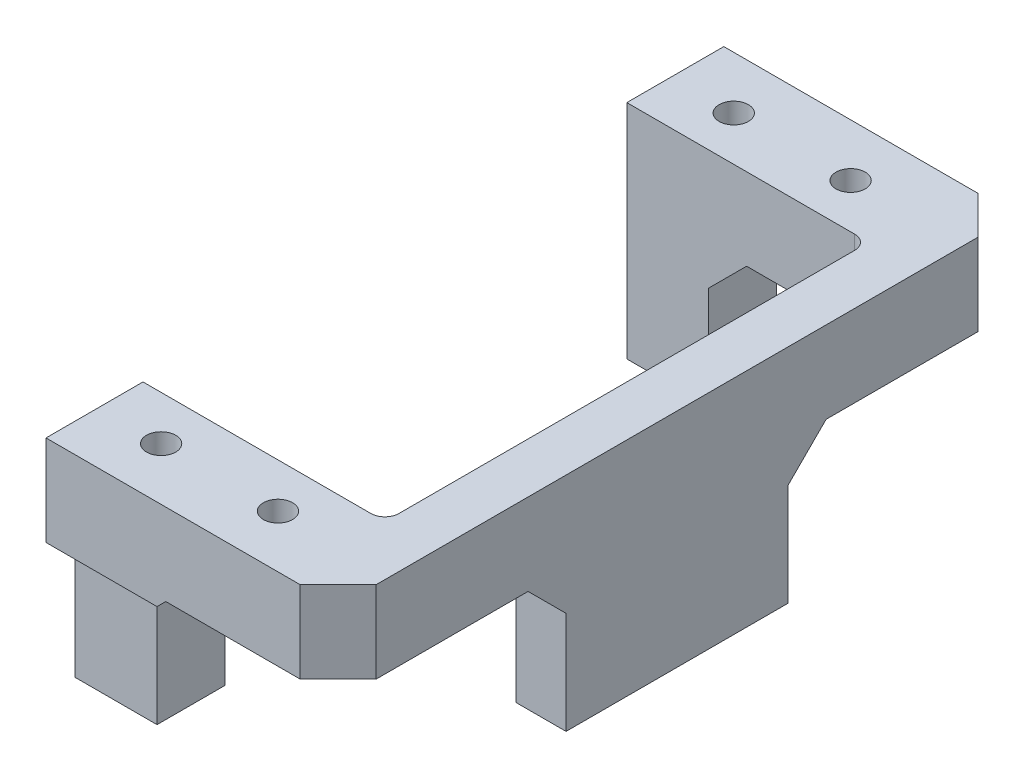
from build123d import *

# Parameters (mm, degrees)
BOSS_EXTRU_1_DEPTH      = 19
ESQUISSE2_W             = 18
ESQUISSE2_H             = 17
ENL_V_MAT_EXTRU_1_DEPTH = 12
TROU_TARAUD_M31_D       = 2.5
TROU_TARAUD_M31_DEPTH   = 8.5
TROU_TARAUD_M31_TIP     = 0.751075774
ESQUISSE7_W             = 25
ESQUISSE7_H             = 8.3
BOSS_EXTRU_2_DEPTH      = 7
CHANFREIN3_SIZE         = 3.25
TROU_TARAUD_M32_D       = 2.5
TROU_TARAUD_M32_DEPTH   = 6
TROU_TARAUD_M32_TIP     = 0.751075774


with BuildPart() as part:
    # Esquisse1 → Boss.-Extru.1 (new body)
    with BuildSketch(Plane(origin=(0, 0, 0), x_dir=(1, 0, 0), z_dir=(0, 1, 0))):
        with BuildLine():
            Line((-9.5, 20.7), (-9.5, 26.5))
            Line((-9.5, 26.5), (15.5, 26.5))
            Line((15.5, 26.5), (15.5, -26.5))
            Line((15.5, -26.5), (-9.5, -26.5))
            Line((-9.5, -26.5), (-9.5, -20.7))
            Line((-9.5, -20.7), (10, -20.7))
            ThreePointArc((10, -20.7), (10.848528137, -20.348528137), (11.2, -19.5))
            Line((11.2, -19.5), (11.2, 19.5))
            ThreePointArc((11.2, 19.5), (10.848528137, 20.348528137), (10, 20.7))
            Line((10, 20.7), (-9.5, 20.7))
        make_face()
    extrude(amount=BOSS_EXTRU_1_DEPTH)

    # Esquisse2 → Enlèv. mat.-Extru.1 (cut)
    with BuildSketch(Plane.XZ):
        with Locations((6.5, 18)):
            Rectangle(ESQUISSE2_W, ESQUISSE2_H)
        with Locations((6.5, -18)):
            Rectangle(ESQUISSE2_W, ESQUISSE2_H)
    extrude(amount=-ENL_V_MAT_EXTRU_1_DEPTH, mode=Mode.SUBTRACT)

    # Trou taraudé M31
    with Locations(Plane(origin=(0, 0, 0), x_dir=(-1, 0, 0), z_dir=(0, -1, 0))):
        with Locations((5.5, 23.6), (-13.35, 0), (5.5, -23.6)):
            Hole(TROU_TARAUD_M31_D / 2, depth=TROU_TARAUD_M31_DEPTH)
            with Locations((0, 0, -(TROU_TARAUD_M31_DEPTH + TROU_TARAUD_M31_TIP / 2))):  # 118° drill point
                Cone(0, TROU_TARAUD_M31_D / 2, TROU_TARAUD_M31_TIP, mode=Mode.SUBTRACT)

    # Esquisse7 → Boss.-Extru.2 (add)
    with BuildSketch(Plane(origin=(0, 19, 0), x_dir=(1, 0, 0), z_dir=(0, 1, 0))):
        with Locations((3, -24.85)):
            Rectangle(ESQUISSE7_W, ESQUISSE7_H)
        with Locations((3, 24.85)):
            Rectangle(ESQUISSE7_W, ESQUISSE7_H)
    extrude(amount=-BOSS_EXTRU_2_DEPTH)

    # Chanfrein3
    # the kernel refuses this chamfer: 3.25 mm, written as the material it adds along each edge
    with BuildSketch(Plane(origin=(11.2, 12, -9.5), x_dir=(0, 0.027495876610586424, -0.9996219169112968), z_dir=(1, 0, 0)), Plane(origin=(11.2, 12, 9.5), x_dir=(0, -0.9996219169112968, -0.027495876610586424), z_dir=(1, 0, 0))) as chanfrein3_piece_1:
        Polygon((CHANFREIN3_SIZE * 0.999621916911, -CHANFREIN3_SIZE * 0.0274958766106), (-CHANFREIN3_SIZE * 0.0274958766106, -CHANFREIN3_SIZE * 0.999621916911), (0, 0), align=None)
    extrude(amount=4.3)
    with BuildSketch(Plane(origin=(-9.5, 12, -26.5), x_dir=(0, -0.9996219169112968, 0.027495876610586424), z_dir=(1, 0, 0))) as chanfrein3_piece_2_section:
        Polygon((CHANFREIN3_SIZE * 0.999621916911, CHANFREIN3_SIZE * 0.0274958766106), (-CHANFREIN3_SIZE * 0.0274958766106, CHANFREIN3_SIZE * 0.999621916911), (0, 0), align=None)
    chanfrein3_piece_2 = extrude(amount=7, mode=Mode.PRIVATE)
    chanfrein3_piece_2 = split(chanfrein3_piece_2, bisect_by=Plane(origin=(-6, 10.864243408, -29), z_dir=(0, 0, 1)), keep=Keep.TOP, mode=Mode.PRIVATE)
    add(chanfrein3_piece_2)
    with BuildSketch(Plane(origin=(-2.5, 12, -26.5), x_dir=(-0.027495876610586424, -0.9996219169112968, 0), z_dir=(0, 0, 1)), Plane(origin=(-2.5, 12, 26.5), x_dir=(0.9996219169112966, 0.027495876610586428, 0), z_dir=(0, 0, -1))) as chanfrein3_piece_3:
        Polygon((CHANFREIN3_SIZE * 0.999621916911, CHANFREIN3_SIZE * 0.0274958766106), (-CHANFREIN3_SIZE * 0.0274958766106, CHANFREIN3_SIZE * 0.999621916911), (0, 0), align=None)
    extrude(amount=5.8)
    with BuildSketch(Plane(origin=(-9.5, 12, 26.5), x_dir=(0, 0.027495876610586424, 0.9996219169112968), z_dir=(1, 0, 0))) as chanfrein3_piece_4_section:
        Polygon((CHANFREIN3_SIZE * 0.999621916911, CHANFREIN3_SIZE * 0.0274958766106), (-CHANFREIN3_SIZE * 0.0274958766106, CHANFREIN3_SIZE * 0.999621916911), (0, 0), align=None)
    chanfrein3_piece_4 = extrude(amount=7, mode=Mode.PRIVATE)
    chanfrein3_piece_4 = split(chanfrein3_piece_4, bisect_by=Plane(origin=(-6, 10.864243408, 29), z_dir=(0, 0, -1)), keep=Keep.TOP, mode=Mode.PRIVATE)
    add(chanfrein3_piece_4)
    with BuildSketch(Plane(origin=(-9.5, 12, -26.5), x_dir=(0, -0.9996219169112968, 0.027495876610586424), z_dir=(1, 0, 0))) as chanfrein3_piece_5a_section:
        Polygon((CHANFREIN3_SIZE * 0.999621916911, CHANFREIN3_SIZE * 0.0274958766106), (-CHANFREIN3_SIZE * 0.0274958766106, CHANFREIN3_SIZE * 0.999621916911), (0, 0), align=None)
    chanfrein3_piece_5a = extrude(amount=15.357969711, mode=Mode.PRIVATE)
    chanfrein3_piece_5a = split(chanfrein3_piece_5a, bisect_by=Plane(origin=(-2.5, 10.864243408, -27.44984941), z_dir=(1, 0, 0)), keep=Keep.TOP, mode=Mode.PRIVATE)
    chanfrein3_piece_5a = split(chanfrein3_piece_5a, bisect_by=Plane(origin=(1.678984855, 10.864243408, -29), z_dir=(0, 0, 1)), keep=Keep.TOP, mode=Mode.PRIVATE)
    with BuildSketch(Plane(origin=(-2.5, 12, -34.857969711), x_dir=(-0.027495876610586424, -0.9996219169112968, 0), z_dir=(0, 0, 1))) as chanfrein3_piece_5b_section:
        Polygon((CHANFREIN3_SIZE * 0.999621916911, CHANFREIN3_SIZE * 0.0274958766106), (-CHANFREIN3_SIZE * 0.0274958766106, CHANFREIN3_SIZE * 0.999621916911), (0, 0), align=None)
    chanfrein3_piece_5b = extrude(amount=14.157969711, mode=Mode.PRIVATE)
    chanfrein3_piece_5b = split(chanfrein3_piece_5b, bisect_by=Plane(origin=(-1.428170713, 10.928170713, -26.5), z_dir=(0, 0, -1)), keep=Keep.TOP, mode=Mode.PRIVATE)
    chanfrein3_piece_5b = split(chanfrein3_piece_5b, bisect_by=Plane(origin=(-1.428170713, 10.928170713, -29), z_dir=(0, 0, 1)), keep=Keep.TOP, mode=Mode.PRIVATE)
    chanfrein3_piece_5 = chanfrein3_piece_5a & chanfrein3_piece_5b
    add(chanfrein3_piece_5)
    with BuildSketch(Plane(origin=(-9.5, 12, 26.5), x_dir=(0, 0.027495876610586424, 0.9996219169112968), z_dir=(1, 0, 0))) as chanfrein3_piece_6a_section:
        Polygon((CHANFREIN3_SIZE * 0.999621916911, CHANFREIN3_SIZE * 0.0274958766106), (-CHANFREIN3_SIZE * 0.0274958766106, CHANFREIN3_SIZE * 0.999621916911), (0, 0), align=None)
    chanfrein3_piece_6a = extrude(amount=15.357969711, mode=Mode.PRIVATE)
    chanfrein3_piece_6a = split(chanfrein3_piece_6a, bisect_by=Plane(origin=(1.678984855, 10.864243408, 29), z_dir=(0, 0, -1)), keep=Keep.TOP, mode=Mode.PRIVATE)
    chanfrein3_piece_6a = split(chanfrein3_piece_6a, bisect_by=Plane(origin=(-2.5, 10.864243408, 27.44984941), z_dir=(1, 0, 0)), keep=Keep.TOP, mode=Mode.PRIVATE)
    with BuildSketch(Plane(origin=(-2.5, 12, 34.857969711), x_dir=(0.9996219169112968, 0.027495876610586424, 0), z_dir=(0, 0, -1))) as chanfrein3_piece_6b_section:
        Polygon((CHANFREIN3_SIZE * 0.999621916911, CHANFREIN3_SIZE * 0.0274958766106), (-CHANFREIN3_SIZE * 0.0274958766106, CHANFREIN3_SIZE * 0.999621916911), (0, 0), align=None)
    chanfrein3_piece_6b = extrude(amount=14.157969711, mode=Mode.PRIVATE)
    chanfrein3_piece_6b = split(chanfrein3_piece_6b, bisect_by=Plane(origin=(-1.428170713, 10.928170713, 29), z_dir=(0, 0, -1)), keep=Keep.TOP, mode=Mode.PRIVATE)
    chanfrein3_piece_6b = split(chanfrein3_piece_6b, bisect_by=Plane(origin=(-1.428170713, 10.928170713, 26.5), z_dir=(0, 0, 1)), keep=Keep.TOP, mode=Mode.PRIVATE)
    chanfrein3_piece_6 = chanfrein3_piece_6a & chanfrein3_piece_6b
    add(chanfrein3_piece_6)
    # the kernel refuses this chamfer: 3.25 mm, written as the material it takes off along each edge
    with BuildSketch(Plane(origin=(15.5, 27.357969711, 29), x_dir=(0.027495876610586424, 0, -0.9996219169112968), z_dir=(0, -1, 0))) as chanfrein3_2_piece_1:
        Polygon((CHANFREIN3_SIZE * 0.999621916911, -CHANFREIN3_SIZE * 0.0274958766106), (-CHANFREIN3_SIZE * 0.0274958766106, -CHANFREIN3_SIZE * 0.999621916911), (0, 0), align=None)
    extrude(amount=23.715939422, mode=Mode.SUBTRACT)
    with BuildSketch(Plane(origin=(15.5, 27.357969711, -29), x_dir=(0.027495876610586424, 0, 0.9996219169112968), z_dir=(0, -1, 0))) as chanfrein3_2_piece_2:
        Polygon((CHANFREIN3_SIZE * 0.999621916911, CHANFREIN3_SIZE * 0.0274958766106), (-CHANFREIN3_SIZE * 0.0274958766106, CHANFREIN3_SIZE * 0.999621916911), (0, 0), align=None)
    extrude(amount=23.715939422, mode=Mode.SUBTRACT)

    # Trou taraudé M32
    with Locations(Plane(origin=(0, 19, 0), x_dir=(1, 0, 0), z_dir=(0, 1, 0))):
        with Locations((-4.15, 24.5), (-4.15, -24.5), (5.85, -24.5), (5.85, 24.5)):
            Hole(TROU_TARAUD_M32_D / 2, depth=TROU_TARAUD_M32_DEPTH)
            with Locations((0, 0, -(TROU_TARAUD_M32_DEPTH + TROU_TARAUD_M32_TIP / 2))):  # 118° drill point
                Cone(0, TROU_TARAUD_M32_D / 2, TROU_TARAUD_M32_TIP, mode=Mode.SUBTRACT)


solid = part.part
